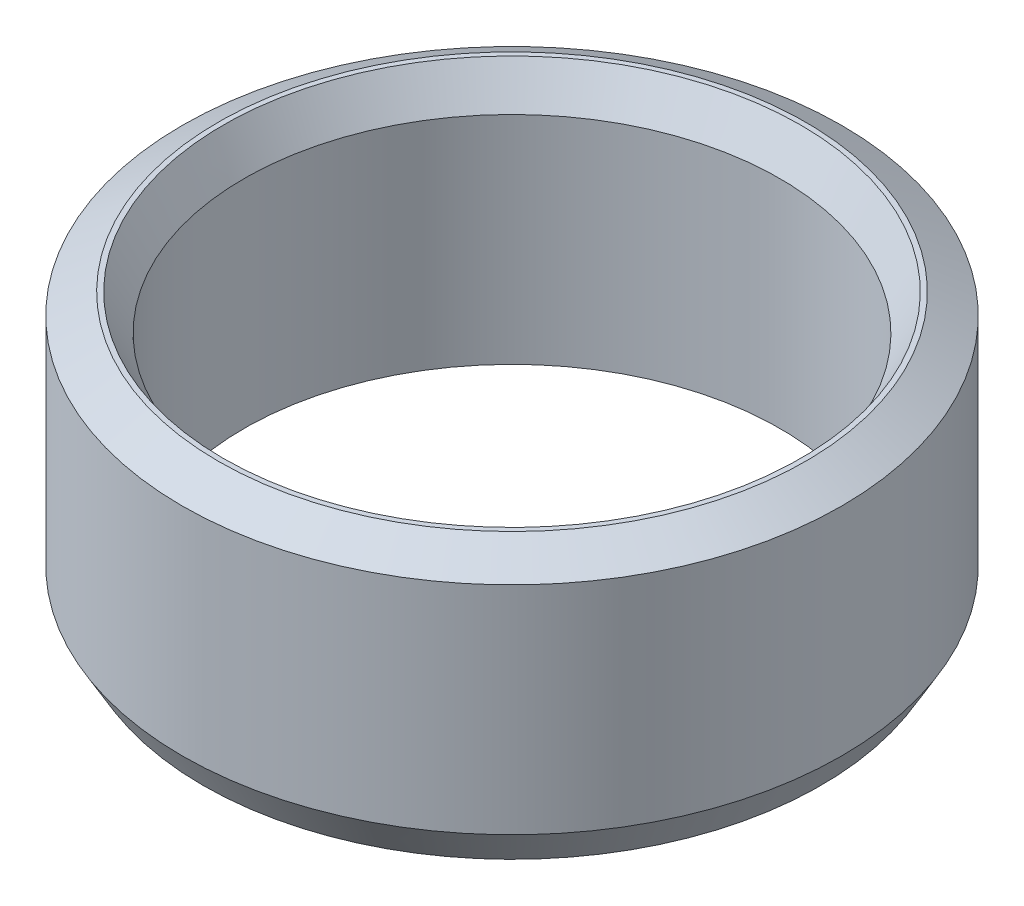
from build123d import *
from OCP.BRepFilletAPI import BRepFilletAPI_MakeChamfer

# Parameters (mm, degrees)
SKETCH1_R           = 27.5
BOSS_EXTRUDE1_DEPTH = 22.784400439
SKETCH2_R           = 22.349485198
CUT_EXTRUDE1_DEPTH  = 46.073594302
CHAMFER1_SIZE       = 1.732460898
CHAMFER1_SIZE2      = 3.000710298


with BuildPart() as part:
    # Sketch1 → Boss-Extrude1 (new body)
    with BuildSketch(Plane(origin=(0, 0, 0), x_dir=(1, 0, 0), z_dir=(0, 1, 0))):
        Circle(SKETCH1_R)
    extrude(amount=BOSS_EXTRUDE1_DEPTH)

    # Sketch2 → Cut-Extrude1 (cut, through all)
    with BuildSketch(Plane(origin=(0, 0, 0), x_dir=(1, 0, 0), z_dir=(0, 1, 0))):
        Circle(SKETCH2_R)
    extrude(amount=CUT_EXTRUDE1_DEPTH, mode=Mode.SUBTRACT)

    # Chamfer1: one chamfer whose edges measure the first distance from different faces: ONE call of the kernel's chamfer builder (chamfer() names one face for all edges)
    chamfer1_edges_1 = [part.edges().sort_by_distance(p)[0] for p in [
        (-22.349485198, 22.784400439, 0),
    ]]
    chamfer1_side_1 = [part.faces().sort_by_distance(p)[0] for p in [
        (-26.722182541, 22.784400439, 0),
    ]]
    chamfer1_edges_2 = [part.edges().sort_by_distance(p)[0] for p in [
        (-22.349485198, 0, 0),
    ]]
    chamfer1_side_2 = [part.faces().sort_by_distance(p)[0] for p in [
        (-22.349485198, 11.392200219, 0),
    ]]
    chamfer1_edges_3 = [part.edges().sort_by_distance(p)[0] for p in [
        (-27.5, 0, 0),
    ]]
    chamfer1_side_3 = [part.faces().sort_by_distance(p)[0] for p in [
        (-26.722182541, 0, 0),
    ]]
    chamfer1_edges_4 = [part.edges().sort_by_distance(p)[0] for p in [
        (-27.5, 22.784400439, 0),
    ]]
    chamfer1_side_4 = [part.faces().sort_by_distance(p)[0] for p in [
        (-27.5, 11.392200219, 0),
    ]]
    chamfer1 = BRepFilletAPI_MakeChamfer(part.part.solid().wrapped)
    for e in chamfer1_edges_1:
        chamfer1.Add(CHAMFER1_SIZE, CHAMFER1_SIZE2, e.wrapped, chamfer1_side_1[0].wrapped)  # the first distance lies on this face
    for e in chamfer1_edges_2:
        chamfer1.Add(CHAMFER1_SIZE, CHAMFER1_SIZE2, e.wrapped, chamfer1_side_2[0].wrapped)  # the first distance lies on this face
    for e in chamfer1_edges_3:
        chamfer1.Add(CHAMFER1_SIZE, CHAMFER1_SIZE2, e.wrapped, chamfer1_side_3[0].wrapped)  # the first distance lies on this face
    for e in chamfer1_edges_4:
        chamfer1.Add(CHAMFER1_SIZE, CHAMFER1_SIZE2, e.wrapped, chamfer1_side_4[0].wrapped)  # the first distance lies on this face
    add(Compound.cast(chamfer1.Shape()), mode=Mode.REPLACE)


solid = part.part
